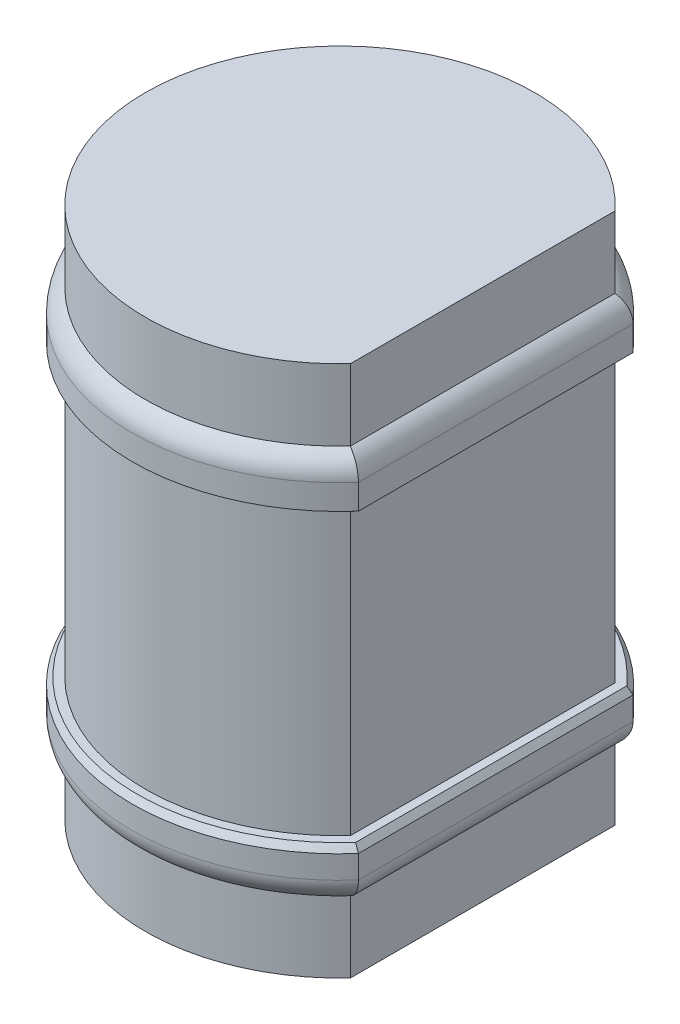
from build123d import *
from OCP.BRepFilletAPI import BRepFilletAPI_MakeChamfer

# Parameters (mm, degrees)
BOSS_EXTRUDE1_DEPTH = 10.25
BOSS_EXTRUDE2_DEPTH = 1
BOSS_EXTRUDE3_DEPTH = 1
FILLET1_R           = 1
CHAMFER1_SIZE       = 0.25
CHAMFER1_SIZE2      = 0.175051885


with BuildPart() as part:
    # Sketch1 → Boss-Extrude1 (new, symmetric)
    with BuildSketch(Plane(origin=(0, 0, 0), x_dir=(1, 0, 0), z_dir=(0, 1, 0))):
        with BuildLine():
            Line((5.5, 5.099019514), (5.5, -5.099019514))
            ThreePointArc((5.5, -5.099019514), (-7.5, 0), (5.5, 5.099019514))
        make_face()
    extrude(amount=BOSS_EXTRUDE1_DEPTH, both=True)

    # Sketch2 → Boss-Extrude2 (add, symmetric)
    with BuildSketch(Plane(origin=(0, 6.5, 0), x_dir=(1, 0, 0), z_dir=(0, 1, 0))):
        with BuildLine():
            Line((6, 5.291502622), (6, -5.291502622))
            ThreePointArc((6, -5.291502622), (-8, 0), (6, 5.291502622))
        make_face()
    extrude(amount=BOSS_EXTRUDE2_DEPTH, both=True)

    # Sketch3 → Boss-Extrude3 (add, symmetric)
    with BuildSketch(Plane(origin=(0, -6.5, 0), x_dir=(1, 0, 0), z_dir=(0, 1, 0))):
        with BuildLine():
            Line((6, -5.291502622), (6, 5.291502622))
            ThreePointArc((6, 5.291502622), (-8, 0), (6, -5.291502622))
        make_face()
    extrude(amount=BOSS_EXTRUDE3_DEPTH, both=True)

    # Fillet1
    # the kernel refuses this fillet: 1 mm, written as the material it takes off along each edge
    with BuildSketch(Plane(origin=(0, 7.5, 0), x_dir=(0.8999821902414007, 0, 0.43592666498883875), z_dir=(0.43592666498883875, 0, -0.8999821902414007))) as fillet1_piece_1:
        with BuildLine():
            CenterArc((7, 0.866025404), FILLET1_R, 300, 60)
            Line((7.5, 0), (7.51, -0.017320508))
            ThreePointArc((7.51, -0.017320508), (7.75, -0.02), (8, -0.02))
            Line((8, -0.02), (8.02, 0))
            Line((8.02, 0), (8.02, 0.866025404))
            Line((8.02, 0.866025404), (8, 0.866025404))
        make_face()
    revolve(axis=Axis((0, 7.5, 0), (0, -1, 0)), revolution_arc=308.311452645, mode=Mode.SUBTRACT)
    with BuildSketch(Plane(origin=(6, 7.5, -7.456566132), x_dir=(0, -1, 0), z_dir=(0, 0, 1))) as fillet1_piece_2:
        with BuildLine():
            CenterArc((0.866025404, -1), FILLET1_R, 90, 60)
            Line((0, -0.5), (-0.017320508, -0.49))
            ThreePointArc((-0.017320508, -0.49), (-0.02, -0.25), (-0.02, 0))
            Line((-0.02, 0), (0, 0.02))
            Line((0, 0.02), (0.866025404, 0.02))
            Line((0.866025404, 0.02), (0.866025404, 0))
        make_face()
    extrude(amount=14.913132263, mode=Mode.SUBTRACT)
    with BuildSketch(Plane(origin=(6, -7.5, 7.456566132), x_dir=(-1, 0, 0), z_dir=(0, 0, -1))) as fillet1_piece_3:
        with BuildLine():
            CenterArc((1, 0.866025404), FILLET1_R, 180, 60)
            Line((0, 0.866025404), (-0.02, 0.866025404))
            Line((-0.02, 0.866025404), (-0.02, 0))
            Line((-0.02, 0), (0, -0.02))
            ThreePointArc((0, -0.02), (0.25, -0.02), (0.49, -0.017320508))
            Line((0.49, -0.017320508), (0.5, 0))
        make_face()
    extrude(amount=14.913132263, mode=Mode.SUBTRACT)
    with BuildSketch(Plane(origin=(0, -7.5, 0), x_dir=(0.8999821902414012, 0, -0.4359266649888379), z_dir=(0.4359266649888379, 0, 0.8999821902414012))) as fillet1_piece_4:
        with BuildLine():
            CenterArc((7, 0.866025404), FILLET1_R, 300, 60)
            Line((8, 0.866025404), (8.02, 0.866025404))
            Line((8.02, 0.866025404), (8.02, 0))
            Line((8.02, 0), (8, -0.02))
            ThreePointArc((8, -0.02), (7.75, -0.02), (7.51, -0.017320508))
            Line((7.51, -0.017320508), (7.5, 0))
        make_face()
    revolve(axis=Axis((0, -7.5, 0), (0, 1, 0)), revolution_arc=308.311452645, mode=Mode.SUBTRACT)

    # Chamfer1: one chamfer whose edges measure the first distance from different faces: ONE call of the kernel's chamfer builder (chamfer() names one face for all edges)
    chamfer1_edges_1 = [part.edges().sort_by_distance(p)[0] for p in [
        (-8, 5.5, 0),
        (6, 5.5, 0),
    ]]
    chamfer1_side_1 = [part.faces().sort_by_distance(p)[0] for p in [
        (5.787397084, 5.5, 0),
    ]]
    chamfer1_edges_2 = [part.edges().sort_by_distance(p)[0] for p in [
        (6, -5.5, 0),
    ]]
    chamfer1_side_2 = [part.faces().sort_by_distance(p)[0] for p in [
        (6, -6.066987298, 0),
    ]]
    chamfer1_edges_3 = [part.edges().sort_by_distance(p)[0] for p in [
        (-8, -5.5, 0),
    ]]
    chamfer1_side_3 = [part.faces().sort_by_distance(p)[0] for p in [
        (-8, -6.066987298, 0),
    ]]
    chamfer1 = BRepFilletAPI_MakeChamfer(part.part.solid().wrapped)
    for e in chamfer1_edges_1:
        chamfer1.Add(CHAMFER1_SIZE, CHAMFER1_SIZE2, e.wrapped, chamfer1_side_1[0].wrapped)  # the first distance lies on this face
    for e in chamfer1_edges_2:
        chamfer1.Add(CHAMFER1_SIZE, CHAMFER1_SIZE2, e.wrapped, chamfer1_side_2[0].wrapped)  # the first distance lies on this face
    for e in chamfer1_edges_3:
        chamfer1.Add(CHAMFER1_SIZE, CHAMFER1_SIZE2, e.wrapped, chamfer1_side_3[0].wrapped)  # the first distance lies on this face
    add(Compound.cast(chamfer1.Shape()), mode=Mode.REPLACE)


solid = part.part
